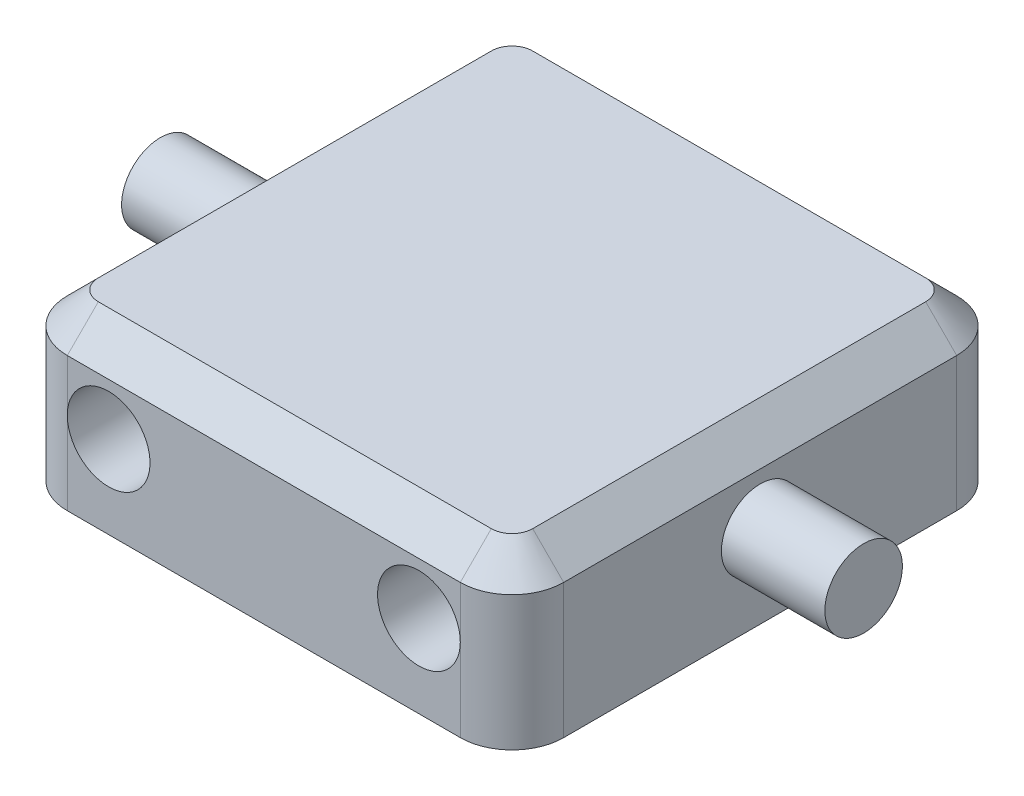
from build123d import *

# Parameters (mm, degrees)
SKETCH1_W           = 48
SKETCH1_H           = 48
BOSS_EXTRUDE1_DEPTH = 16
SKETCH2_R           = 4
CUT_EXTRUDE1_DEPTH  = 100
SKETCH3_R           = 3.75
BOSS_EXTRUDE2_DEPTH = 10
FILLET1_R           = 5
CHAMFER1_SIZE       = 3


with BuildPart() as part:
    # Sketch1 → Boss-Extrude1 (new body)
    with BuildSketch(Plane(origin=(0, 0, 0), x_dir=(1, 0, 0), z_dir=(0, 1, 0))):
        Rectangle(SKETCH1_W, SKETCH1_H)
    extrude(amount=BOSS_EXTRUDE1_DEPTH)

    # Sketch2 → Cut-Extrude1 (cut)
    with BuildSketch(Plane.XY.offset(24)):
        with Locations((-15, 8)):
            Circle(SKETCH2_R)
        with Locations((15, 8)):
            Circle(SKETCH2_R)
    extrude(amount=-CUT_EXTRUDE1_DEPTH, mode=Mode.SUBTRACT)

    # Sketch3 → Boss-Extrude2 (add)
    with BuildSketch(Plane(origin=(24, 0, 0), x_dir=(0, 0, -1), z_dir=(1, 0, 0))):
        with Locations(Location((0, 8, 0), (0, 0, 180))):
            Circle(SKETCH3_R)
    boss_extrude2 = extrude(amount=BOSS_EXTRUDE2_DEPTH)

    # Mirror1: Boss-Extrude2 across plane
    add(boss_extrude2.mirror(Plane(origin=(0, 0, 0), x_dir=(0, 0, 1), z_dir=(1, 0, 0))))

    # Fillet1
    fillet1_edges = [part.edges().sort_by_distance(p)[0] for p in [
        (24, 8, 24),
        (-24, 8, 24),
        (-24, 8, -24),
        (24, 8, -24),
    ]]
    fillet(fillet1_edges, radius=FILLET1_R - 0.0001)  # a hair under: the kernel refuses the full size

    # Chamfer1
    chamfer1_edges = [part.edges().sort_by_distance(p)[0] for p in [
        (0, 16, -24),
        (24, 16, 0),
        (-24, 16, 0),
        (0, 16, 24),
        (-22.535563195, 16, 22.535563195),
        (-22.535563195, 16, -22.535563195),
        (22.535563195, 16, 22.535563195),
        (22.535563195, 16, -22.535563195),
    ]]
    chamfer(chamfer1_edges, length=CHAMFER1_SIZE)


solid = part.part
